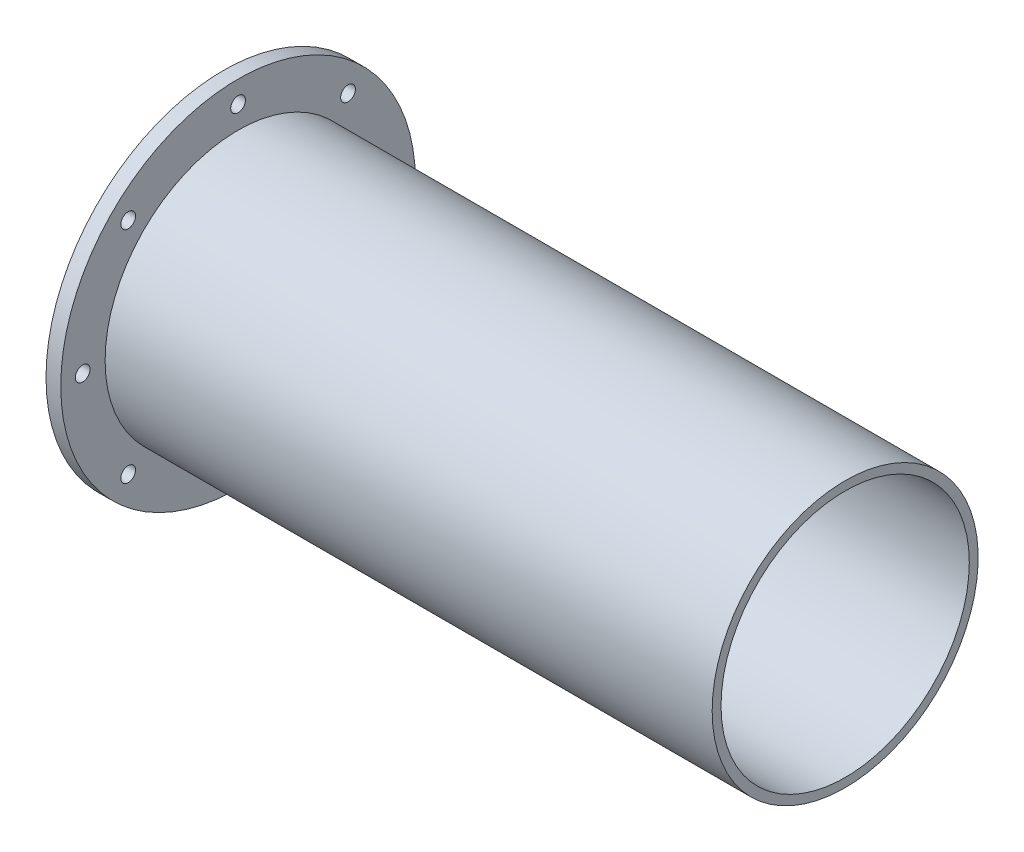
from build123d import *

# Parameters (mm, degrees)
SKETCH2_R          = 3.175
CUT_EXTRUDE1_DEPTH = 283.24063521
CIRPATTERN1_COUNT  = 8


with BuildPart() as part:
    # Sketch1 → Revolve1 (revolve)
    with BuildSketch(Plane.XY):
        Polygon((0, 76.2), (6.35, 76.2), (6.35, 57.15), (267.208, 57.15), (267.208, 53.34), (0, 53.34), align=None)
    revolve(axis=Axis((0, 0, 0), (1, 0, 0)))

    # Sketch2 → Cut-Extrude1 (cut, through all)
    with BuildSketch(Plane(origin=(6.35, 0, 0), x_dir=(0, 0, -1), z_dir=(1, 0, 0))):
        with Locations((66.802, 0)):
            Circle(SKETCH2_R)
    cut_extrude1 = extrude(amount=-CUT_EXTRUDE1_DEPTH, mode=Mode.SUBTRACT)

    # CirPattern1: Cut-Extrude1 ×8 about axis
    cirpattern1_axis = Axis((0, 0, 0), (-1, 0, 0))
    for i in range(1, CIRPATTERN1_COUNT):
        add(cut_extrude1.rotate(cirpattern1_axis, i * 360 / CIRPATTERN1_COUNT), mode=Mode.SUBTRACT)


solid = part.part
